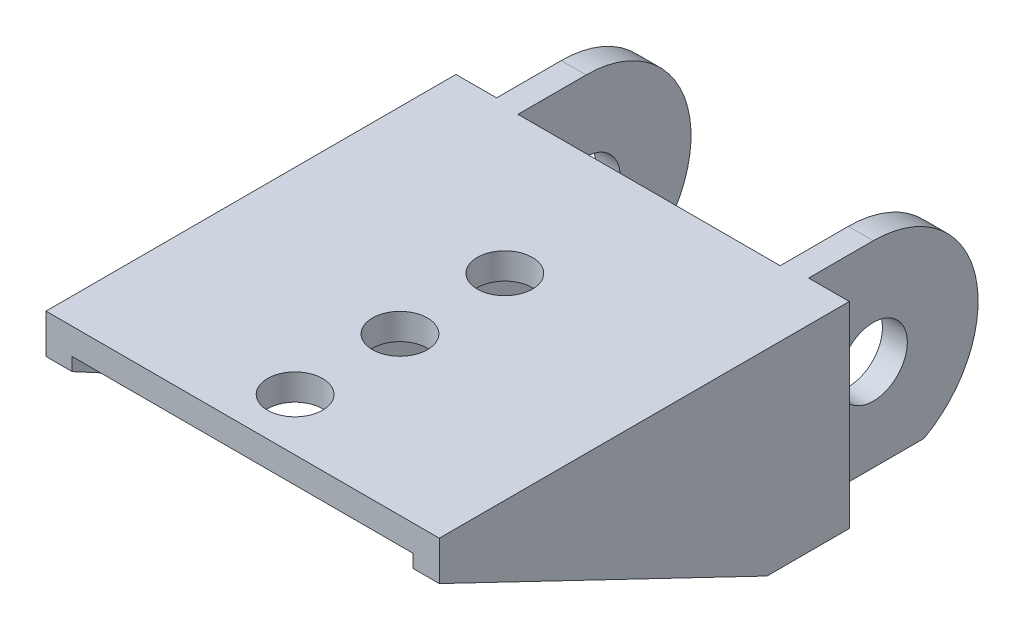
from build123d import *

# Parameters (mm, degrees)
SKETCH_1_W               = 30
SKETCH_1_H               = 15
EXTRUDE_1_DEPTH          = 18
CUT_EXTRUDE_1_REACH      = 28.843
SKETCH_2_W               = 20
SKETCH_2_H               = 10
CUT_EXTRUDE_2_REACH      = 29.668
SKETCH_3_W               = 20
SKETCH_3_H               = 12
EXTRUDE_4_DEPTH          = 20
SKETCH_10_R              = 2.6
CUT_EXTRUDE_8_DEPTH      = 35.965796737
CUT_EXTRUDE_9_DEPTH      = 35.965796737
CUT_EXTRUDE_9_DEPTH_BACK = 35.965796737
SKETCH_12_W              = 1.696031958
SKETCH_12_H              = 15
SKETCH_17_W              = 3.1
SKETCH_17_H              = 15
EXTRUDE_8_DEPTH          = 0.27
EXTRUDE_9_DEPTH          = 13
CHAMFER_1_SIZE           = 25
CHAMFER_1_SIZE2          = 12
SKETCH_19_R              = 2.1
CUT_EXTRUDE_10_DEPTH     = 13
CHAMFER_2_SIZE           = 25
CHAMFER_2_SIZE_2         = 3


with BuildPart() as part:
    # 草圖1 → 填料-伸長1 (new body)
    with BuildSketch(Plane.XY):
        with Locations((2.249045701, -2.44972067)):
            Rectangle(SKETCH_1_W, SKETCH_1_H)
    extrude(amount=EXTRUDE_1_DEPTH)

    # 草圖2 → 除料-伸長1 (cut, up to next)
    with BuildSketch(Plane.XY.offset(18), mode=Mode.PRIVATE) as cut_extrude_1_sk1:
        with Locations((2.249045701, -1.94972067)):
            Rectangle(SKETCH_2_W, SKETCH_2_H)
    cut_extrude_1_tool1 = extrude(cut_extrude_1_sk1.sketch, amount=-CUT_EXTRUDE_1_REACH, mode=Mode.PRIVATE) & part.part
    add(cut_extrude_1_tool1.solids().sort_by_distance((2.249046, -1.949721, 18))[0], mode=Mode.SUBTRACT)

    # 草圖3 → 除料-伸長2 (cut, up to next)
    with BuildSketch(Plane(origin=(0, -6.94972067, 0), x_dir=(1, 0, 0), z_dir=(0, 1, 0)), mode=Mode.PRIVATE) as cut_extrude_2_sk1:
        with Locations((2.249045701, -12)):
            Rectangle(SKETCH_3_W, SKETCH_3_H)
    cut_extrude_2_tool1 = extrude(cut_extrude_2_sk1.sketch, amount=-CUT_EXTRUDE_2_REACH, mode=Mode.PRIVATE) & part.part
    add(cut_extrude_2_tool1.solids().sort_by_distance((2.249046, -6.949721, 12))[0], mode=Mode.SUBTRACT)

    # 草圖9 → 填料-伸長4 (add)
    with BuildSketch(Plane(origin=(0, 0, 0), x_dir=(-1, 0, 0), z_dir=(0, 0, -1))):
        Polygon((9.650954299, 5.05027933), (7.750954299, 5.05027933), (7.750954299, 3.05027933), (7.750954299, -6.94972067), (7.750954299, -9.94972067), (9.650954299, -9.94972067), align=None)
        Polygon((-12.249045701, 3.05027933), (-12.249045701, 5.05027933), (-14.149045701, 5.05027933), (-14.149045701, -9.94972067), (-12.249045701, -9.94972067), (-12.249045701, -6.94972067), align=None)
    extrude(amount=EXTRUDE_4_DEPTH)

    # 草圖10 → 除料-伸長8 (cut, through all)
    with BuildSketch(Plane(origin=(14.149045701, 0, 0), x_dir=(0, 0, -1), z_dir=(1, 0, 0))):
        with Locations((5.2, -2.94972067)):
            Circle(SKETCH_10_R)
    extrude(amount=-CUT_EXTRUDE_8_DEPTH, mode=Mode.SUBTRACT)

    # 草圖12 → 除料-伸長9 (cut, two sides: drawn at the far end of the back side and taken through both)
    with BuildSketch(Plane(origin=(14.149045701, 0, 0), x_dir=(0, 0, -1), z_dir=(1, 0, 0)).offset(-CUT_EXTRUDE_9_DEPTH_BACK)):
        with BuildLine():
            Line((18.303968042, 5.05027933), (5.2, 5.05027933))
            ThreePointArc((5.2, 5.05027933), (10.856854249, 2.707133579), (13.2, -2.94972067))
            ThreePointArc((13.2, -2.94972067), (12.091439137, -7.012732683), (9.072983346, -9.94972067))
            Line((9.072983346, -9.94972067), (18.303968042, -9.94972067))
            Line((18.303968042, -9.94972067), (18.303968042, 5.05027933))
        make_face()
        with Locations((19.151984021, -2.44972067)):
            Rectangle(SKETCH_12_W, SKETCH_12_H)
    extrude(amount=CUT_EXTRUDE_9_DEPTH + CUT_EXTRUDE_9_DEPTH_BACK, mode=Mode.SUBTRACT)

    # 草圖17 → 填料-伸長8 (add)
    with BuildSketch(Plane(origin=(0, 0, 0), x_dir=(-1, 0, 0), z_dir=(0, 0, -1))):
        with Locations((-15.699045701, -2.44972067)):
            Rectangle(SKETCH_17_W, SKETCH_17_H)
        with Locations((11.200954299, -2.44972067)):
            Rectangle(SKETCH_17_W, SKETCH_17_H)
    extrude(amount=EXTRUDE_8_DEPTH)

    # 草圖18 → 填料-伸長9 (add)
    with BuildSketch(Plane.XY.offset(18)):
        Polygon((-12.750954299, 5.05027933), (-12.750954299, -9.94972067), (-7.750954299, -9.94972067), (-7.750954299, 3.05027933), (12.249045701, 3.05027933), (12.249045701, -9.94972067), (17.249045701, -9.94972067), (17.249045701, 5.05027933), align=None)
    extrude(amount=EXTRUDE_9_DEPTH)

    # 導角1
    chamfer_1_edges = [part.edges().sort_by_distance(p)[0] for p in [
        (14.749045701, -9.94972067, 31),
        (-10.250954299, -9.94972067, 31),
    ]]
    chamfer_1_side = [part.faces().sort_by_distance(p)[0] for p in [
        (13.648461643, -9.94972067, -4.671491673),
    ]]
    chamfer(chamfer_1_edges, length=CHAMFER_1_SIZE, length2=CHAMFER_1_SIZE2, reference=chamfer_1_side[0])

    # 草圖19 → 除料-伸長10 (cut)
    with BuildSketch(Plane(origin=(0, 3.05027933, 0), x_dir=(-1, 0, 0), z_dir=(0, -1, 0))):
        with Locations(Location((-2.249045701, -27, 0), (0, 0, 90))):
            Circle(SKETCH_19_R)
        with Locations(Location((-2.249045701, -19, 0), (0, 0, 90))):
            Circle(SKETCH_19_R)
        with Locations(Location((-2.249045701, -11, 0), (0, 0, 90))):
            Circle(SKETCH_19_R)
    extrude(amount=-CUT_EXTRUDE_10_DEPTH, mode=Mode.SUBTRACT)

    # 導角2
    # the kernel refuses this chamfer: 25, 3 mm, written as the material it takes off along each edge
    with BuildSketch(Plane(origin=(12.249045701, 3.05027933, 31), x_dir=(-0.004583716135178889, 0, -0.9999894947180156), z_dir=(0, -1, 0)), Plane(origin=(-7.750954299, -62.93259543, 31), x_dir=(0.004583716135178923, 0, -0.9999894947180156), z_dir=(0, 1, 0))) as chamfer_2_piece_1:
        Polygon((CHAMFER_2_SIZE * 0.999989494718, CHAMFER_2_SIZE * 0.00458371613518), (-CHAMFER_2_SIZE_2 * 0.00458371613518, CHAMFER_2_SIZE_2 * 0.999989494718), (0, 0), align=None)
    extrude(amount=65.98287476, mode=Mode.SUBTRACT)


solid = part.part
